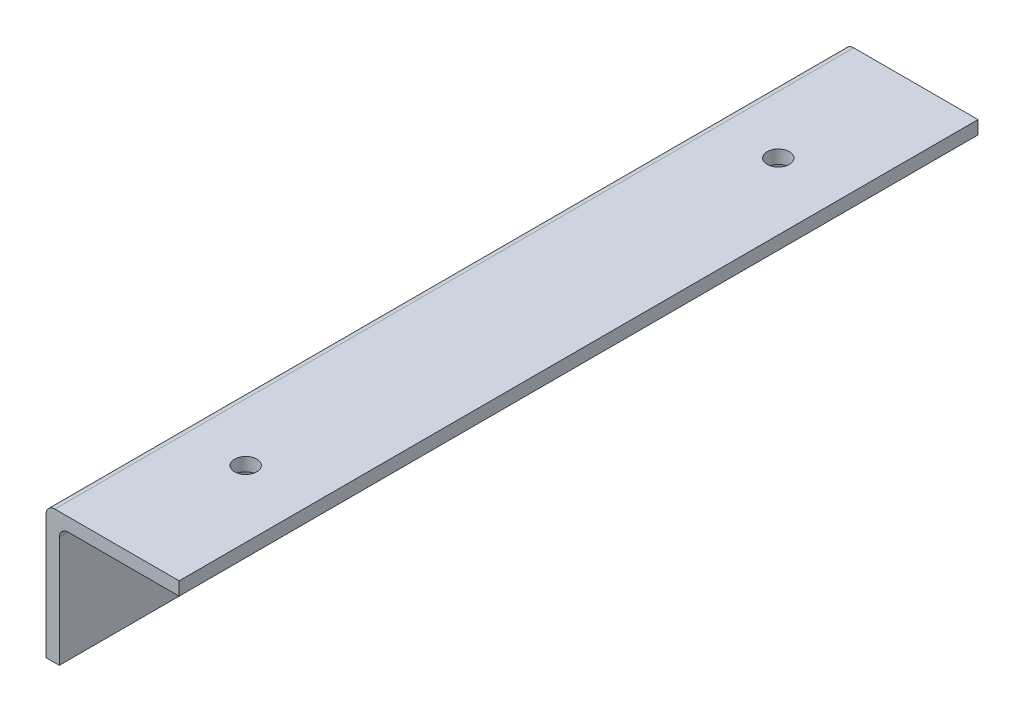
from build123d import *

# Parameters (mm, degrees)
BOSS_EXTRU_1_DEPTH      = 180
ESQUISSE2_R             = 3
ENL_V_MAT_EXTRU_1_DEPTH = 180
ESQUISSE3_R             = 2.5
ENL_V_MAT_EXTRU_2_DEPTH = 180
CONG_1_R                = 2


with BuildPart() as part:
    # Esquisse1 → Boss.-Extru.1 (new body)
    with BuildSketch(Plane.XY):
        Polygon((0, 0), (0, -30), (3, -30), (3, -3), (30, -3), (30, 0), align=None)
    extrude(amount=BOSS_EXTRU_1_DEPTH)

    # Esquisse2 → Enlèv. mat.-Extru.1 (cut)
    with BuildSketch(Plane(origin=(3, 0, 0), x_dir=(0, 0, -1), z_dir=(1, 0, 0))):
        with Locations((-25, -20)):
            Circle(ESQUISSE2_R)
        with Locations((-155, -20)):
            Circle(ESQUISSE2_R)
    extrude(amount=-ENL_V_MAT_EXTRU_1_DEPTH, mode=Mode.SUBTRACT)

    # Esquisse3 → Enlèv. mat.-Extru.2 (cut)
    with BuildSketch(Plane.XZ.offset(3)):
        with Locations((15, 150)):
            Circle(ESQUISSE3_R)
        with Locations((15, 30)):
            Circle(ESQUISSE3_R)
    extrude(amount=-ENL_V_MAT_EXTRU_2_DEPTH, mode=Mode.SUBTRACT)

    # Congé1
    cong_1_edges = [part.edges().sort_by_distance(p)[0] for p in [
        (0, 0, 90),
        (3, -3, 90),
    ]]
    fillet(cong_1_edges, radius=CONG_1_R)


solid = part.part
